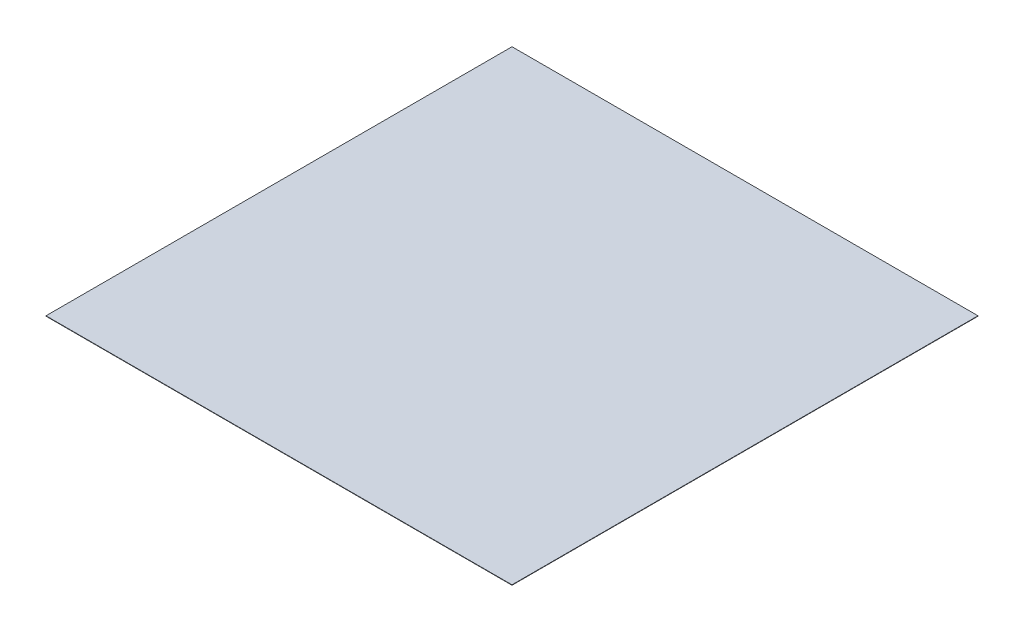
from build123d import *

# Parameters (mm, degrees)
SKETCH1_W           = 3048
SKETCH1_H           = 3048
BOSS_EXTRUDE1_DEPTH = 2.54


with BuildPart() as part:
    # Sketch1 → Boss-Extrude1 (new body)
    with BuildSketch(Plane(origin=(0, 0, 0), x_dir=(1, 0, 0), z_dir=(0, 1, 0))):
        Rectangle(SKETCH1_W, SKETCH1_H)
    extrude(amount=BOSS_EXTRUDE1_DEPTH)


solid = part.part
